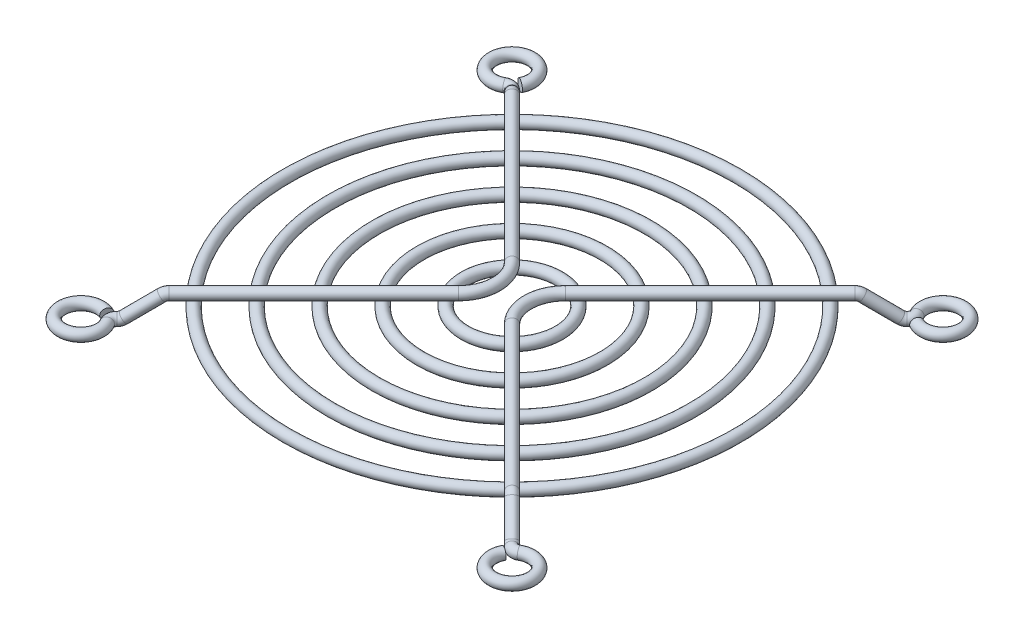
from build123d import *

# Parameters (mm, degrees)
SKETCH1_R               = 0.9
SKETCH3_R               = 0.9
SKETCH5_R               = 0.9
SKETCH7_R               = 0.9
CUT_EXTRUDE1_DEPTH      = 57.624155773
CUT_EXTRUDE1_DEPTH_BACK = 57.624155773
CIRPATTERN1_COUNT       = 4
SKETCH10_R              = 0.9
SKETCH12_R              = 0.9


with BuildPart() as part:
    # Sketch1 → Revolve1 (revolve)
    with BuildSketch(Plane.XY, mode=Mode.PRIVATE) as revolve1_sk:
        with Locations((-7.8, 2.8)):
            Circle(SKETCH1_R)
        with Locations((-37.35, 2.8)):
            Circle(SKETCH1_R)
        with Locations((-29.9625, 2.8)):
            Circle(SKETCH1_R)
        with Locations((-22.575, 2.8)):
            Circle(SKETCH1_R)
        with Locations((-15.1875, 2.8)):
            Circle(SKETCH1_R)
    revolve(revolve1_sk.sketch.rotate(Axis((0, 2.8, 0), (0, -1, 0)), 270), axis=Axis((0, 2.8, 0), (0, -1, 0)))


with BuildPart() as body_2:
    # Sweep1: sweep along a path in Sketch2
    with BuildLine(Plane(origin=(0, 0, 0), x_dir=(1, 0, 0), z_dir=(0, 1, 0))) as sweep1_path:
        Line((-28.461047943, 28.461047943), (-4.438477631, 4.438477631))
        ThreePointArc((-4.438477631, 4.438477631), (-3.077804769, 2.402086785), (-2.6, 0))
    # Sketch3 → Sweep1 (sweep)
    with BuildSketch(Plane.XY):
        with Locations((-2.6, 4.6)):
            Circle(SKETCH3_R)
    sweep(path=sweep1_path.line)

    # Sweep2: sweep along a path in Sketch4
    with BuildLine(Plane(origin=(0, 0, 0), x_dir=(-0.7071067811865488, 0, -0.7071067811865464), z_dir=(0.7071067811865464, 0, -0.7071067811865488))) as sweep2_path:
        ThreePointArc((40.25, 4.6), (40.679361812, 4.533150941), (41.068076935, 4.338932211))
        Line((41.068076935, 4.338932211), (45.54005792, 1.161067789))
        ThreePointArc((45.54005792, 1.161067789), (45.928773043, 0.966849059), (46.358134855, 0.9))
    # Sketch5 → Sweep2 (sweep)
    with BuildSketch(Plane(origin=(-28.461047943, 0, -28.461047943), x_dir=(-0.7071067811865516, 0, 0.7071067811865435), z_dir=(-0.7071067811865435, 0, -0.7071067811865516))):
        with Locations((0, 4.6)):
            Circle(SKETCH5_R)
    sweep(path=sweep2_path.line)

    # Sweep3: sweep along a path in Sketch6
    with BuildLine(Plane(origin=(0, 0, 0), x_dir=(1, 0, 0), z_dir=(0, 1, 0))) as sweep3_path:
        ThreePointArc((-32.780151519, 32.780151519), (-33.442901168, 33.108394301), (-34.169002571, 32.967834094))
        ThreePointArc((-34.169002571, 32.967834094), (-38.050802877, 37.974029254), (-32.915800838, 34.264296426))
    # Sketch7 → Sweep3 (sweep)
    with BuildSketch(Plane(origin=(-32.780151519, 0, -32.780151519), x_dir=(-0.7071067811865515, 2.0261570199408882e-15, 0.7071067811865437), z_dir=(-0.7071067811865437, -2.0261570199409115e-15, -0.7071067811865515))):
        with Locations((0, 0.9)):
            Circle(SKETCH7_R)
    sweep(path=sweep3_path.line)

    # Sketch8 → Cut-Extrude1 (cut, two sides: drawn at the far end of the back side and taken through both)
    with BuildSketch(Plane(origin=(0, 0, 0), x_dir=(1, 0, 0), z_dir=(0, 1, 0)).offset(-CUT_EXTRUDE1_DEPTH_BACK)):
        Polygon((-97.53238372, -88.655428458), (-5.074873734, 3.802081528), (-3.802081528, 5.074873734), (88.655428458, 97.53238372), (273.57044843, -87.382636252), (87.382636252, -273.57044843), align=None)
    extrude(amount=CUT_EXTRUDE1_DEPTH + CUT_EXTRUDE1_DEPTH_BACK, mode=Mode.SUBTRACT)


with BuildPart() as cirpattern1_1:
    # CirPattern1: pattern copy
    add(body_2.part.rotate(Axis((0, 0, 0), (0, 1, 0)), 1 * 360 / CIRPATTERN1_COUNT))


with BuildPart() as cirpattern1_2:
    # CirPattern1: pattern copy
    add(body_2.part.rotate(Axis((0, 0, 0), (0, 1, 0)), 2 * 360 / CIRPATTERN1_COUNT))



with BuildPart() as cirpattern1_3:
    # CirPattern1: pattern copy
    add(body_2.part.rotate(Axis((0, 0, 0), (0, 1, 0)), 3 * 360 / CIRPATTERN1_COUNT))


with BuildPart() as body_2_1:
    add(body_2.part)

    add(cirpattern1_1.part)  # Sweep4 merges CirPattern1_1
    # Sweep4: sweep along a path in Sketch9
    with BuildLine(Plane(origin=(0, 0, 0), x_dir=(1, 0, 0), z_dir=(0, 1, 0))) as sweep4_path:
        ThreePointArc((-4.438477631, 4.438477631), (-2.6, 0), (-4.438477631, -4.438477631))
    # Sketch10 → Sweep4 (sweep)
    with BuildSketch(Plane(origin=(-4.438477631, 0, -4.438477631), x_dir=(0.7071067811865474, 0, -0.7071067811865477), z_dir=(0.7071067811865477, 0, 0.7071067811865474))):
        with Locations((0, 4.6)):
            Circle(SKETCH10_R)
    sweep(path=sweep4_path.line)


with BuildPart() as cirpattern1_2_1:
    add(cirpattern1_2.part)

    add(cirpattern1_3.part)  # Sweep5 merges CirPattern1_3
    # Sweep5: sweep along a path in Sketch11
    with BuildLine(Plane(origin=(0, 0, 0), x_dir=(1, 0, 0), z_dir=(0, 1, 0))) as sweep5_path:
        ThreePointArc((4.438477631, 4.438477631), (2.6, 0), (4.438477631, -4.438477631))
    # Sketch12 → Sweep5 (sweep)
    with BuildSketch(Plane(origin=(4.438477631, 0, -4.438477631), x_dir=(0.7071067811865551, 2.0443912222444393e-15, 0.7071067811865399), z_dir=(-0.7071067811865399, 2.044391222244483e-15, 0.7071067811865551))):
        with Locations((0, 4.6)):
            Circle(SKETCH12_R)
    sweep(path=sweep5_path.line)


solid = Compound([part.part, body_2_1.part, cirpattern1_2_1.part])
